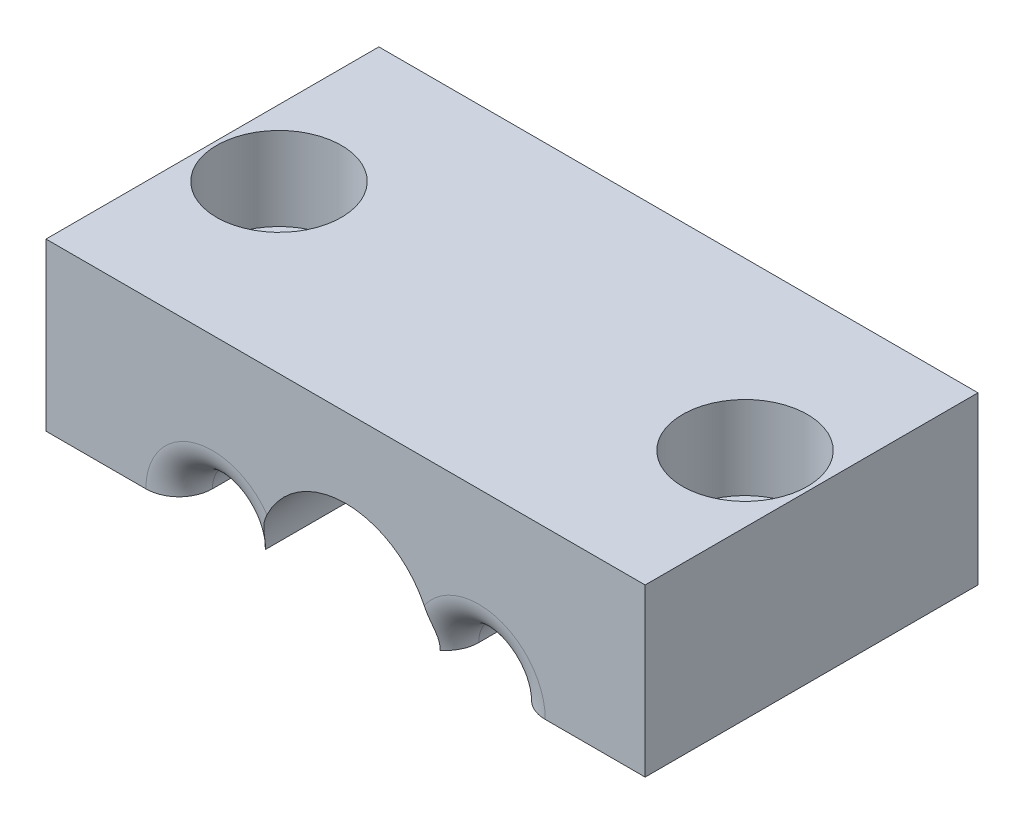
from build123d import *

# Parameters (mm, degrees)
BOSS_EXTRUDE1_DEPTH = 20
SKETCH2_W           = 0.8000000000000007
SKETCH2_H           = 0.7999999999999989
SKETCH2_H_2         = 0.8000000000000007
CHAMFER1_SIZE       = 0.4
FILLET2_R           = 2
SKETCH3_R           = 2.100000000000004
SKETCH3_R_2         = 2.100000000000001
CUT_EXTRUDE1_DEPTH  = 44.163354633534205
SKETCH4_R           = 3.7499999999999996
SKETCH4_R_2         = 3.750000000000006
CUT_EXTRUDE2_DEPTH  = 5


# Some blends are built 0.0001 mm under size
with BuildPart() as part:
    # Sketch1 → Boss-Extrude1 (new body)
    with BuildSketch(Plane.XY):
        with BuildLine():
            Line((0.9198479389646088, 12.89190109356241), (0.9198479389646088, 2.89190109356241))
            Line((0.9198479389646081, 2.89190109356241), (8.919847938964608, 2.89190109356241))
            ThreePointArc((8.919847938964608, 2.8919010935624105), (10.919847938964608, 4.89190109356241), (12.919847938964608, 2.89190109356241))
            Line((12.919847938964608, 2.89190109356241), (13.669847938964606, 2.89190109356241))
            ThreePointArc((13.669847938964608, 2.8919010935624114), (18.919847938964608, 8.14190109356241), (24.169847938964608, 2.89190109356241))
            Line((24.169847938964608, 2.89190109356241), (24.919847938964608, 2.89190109356241))
            ThreePointArc((24.919847938964608, 2.8919010935624105), (26.919847938964608, 4.891901093562406), (28.919847938964608, 2.89190109356241))
            Line((28.919847938964605, 2.89190109356241), (36.91984793896461, 2.89190109356241))
            Line((36.91984793896461, 2.89190109356241), (36.91984793896461, 12.89190109356241))
            Line((36.91984793896461, 12.89190109356241), (0.9198479389646088, 12.89190109356241))
        make_face()
    extrude(amount=BOSS_EXTRUDE1_DEPTH)

    # Sweep2: sweep along a curve in space
    with BuildLine() as sweep2_path:
        ThreePointArc((24.169847938964608, 2.89190109356241, 20), (22.632158540193984, 6.604211694791784, 20), (18.919847938964608, 8.141901093562412, 20))
        ThreePointArc((18.919847938964608, 8.141901093562412, 20), (15.207537337735232, 6.604211694791786, 20), (13.669847938964606, 2.89190109356241, 20))
    # Sketch2 → Sweep2 (sweep)
    with BuildSketch(Plane.XZ.offset(-2.89190109356241)):
        with Locations((14.069847938964607, 13.400000000000006)):
            Rectangle(SKETCH2_W, SKETCH2_H)
        with Locations((14.069847938964607, 10.400000000000004)):
            Rectangle(SKETCH2_W, SKETCH2_H_2)
        with Locations((14.069847938964607, 7.400000000000003)):
            Rectangle(SKETCH2_W, SKETCH2_H_2)
        Polygon((13.669847938964608, 4.8000000000000025), (14.469847938964607, 4.8000000000000025), (14.469847938964609, 4.000000000000002), (13.669847938964608, 4.000000000000002), align=None)
    sweep(path=sweep2_path.line)

    # Chamfer1
    chamfer1_edges = [part.edges().sort_by_distance(p)[0] for p in [
        (18.919847938964608, 7.341901093562408, 4.000000000000002),
        (18.919847938964608, 7.341901093562411, 4.8000000000000025),
        (18.919847938964608, 7.341901093562411, 7.0000000000000036),
        (18.919847938964608, 7.341901093562413, 7.800000000000004),
        (18.919847938964608, 7.341901093562413, 13.800000000000004),
        (18.919847938964608, 7.341901093562411, 13.000000000000005),
        (18.919847938964608, 7.341901093562413, 10.800000000000004),
        (18.919847938964608, 7.341901093562411, 10.000000000000004),
    ]]
    chamfer(chamfer1_edges, length=CHAMFER1_SIZE - 0.0001)  # a hair under: the kernel refuses the full size

    # Fillet2
    # the kernel refuses this fillet: 2 mm, written as the material it takes off along each edge
    with BuildSketch(Plane(origin=(10.919847938964608, 2.89190109356241, 0), x_dir=(-0.003141587485879782, -0.9999950652018582, 0), z_dir=(0.9999950652018582, -0.003141587485879782, 0))) as fillet2_piece_1:
        with BuildLine():
            CenterArc((2 + FILLET2_R, -FILLET2_R), FILLET2_R, 89.99999999999997, 90)
            Line((2 + FILLET2_R, 2.2e-16), (2, 0))
            Line((2, 0), (2, -FILLET2_R))
        make_face()
    revolve(axis=Axis((10.919847938964608, 2.89190109356241, 0), (0, 0, -1)), revolution_arc=359.64000000000004, mode=Mode.SUBTRACT)
    with BuildSketch(Plane(origin=(26.919847938964608, 2.8919010935624057, 0), x_dir=(-0.003141587485879782, -0.9999950652018582, 0), z_dir=(0.9999950652018582, -0.003141587485879782, 0))) as fillet2_piece_2:
        with BuildLine():
            CenterArc((1.9999999999999987 + FILLET2_R, -FILLET2_R), FILLET2_R, 90, 90)
            Line((1.999999999999998, -FILLET2_R), (1.9999999999999987, 0))
            Line((1.9999999999999987, 0), (1.9999999999999987 + FILLET2_R, 0))
        make_face()
    revolve(axis=Axis((26.919847938964608, 2.8919010935624057, 0), (0, 0, -1)), revolution_arc=359.64, mode=Mode.SUBTRACT)
    with BuildSketch(Plane(origin=(10.919847938964608, 2.89190109356241, 20), x_dir=(-0.003141587485879782, -0.9999950652018582, 0), z_dir=(0.9999950652018582, -0.003141587485879782, 0))) as fillet2_piece_3:
        with BuildLine():
            CenterArc((1.9999999999999987 + FILLET2_R, FILLET2_R), FILLET2_R, 180, 90)
            Line((1.999999999999999, FILLET2_R), (1.9999999999999987, 0))
            Line((1.9999999999999987, 0), (1.9999999999999987 + FILLET2_R, 0))
        make_face()
    revolve(axis=Axis((10.919847938964608, 2.89190109356241, 20), (0, 0, -1)), revolution_arc=359.64000000000004, mode=Mode.SUBTRACT)
    with BuildSketch(Plane(origin=(26.919847938964608, 2.8919010935624057, 20), x_dir=(-0.003141587485879782, -0.9999950652018582, 0), z_dir=(0.9999950652018582, -0.003141587485879782, 0))) as fillet2_piece_4:
        with BuildLine():
            CenterArc((1.9999999999999987 + FILLET2_R, FILLET2_R), FILLET2_R, 180, 90)
            Line((1.999999999999998, FILLET2_R), (1.9999999999999987, 0))
            Line((1.9999999999999987, 0), (1.9999999999999987 + FILLET2_R, 0))
        make_face()
    revolve(axis=Axis((26.919847938964608, 2.8919010935624057, 20), (0, 0, -1)), revolution_arc=359.64, mode=Mode.SUBTRACT)

    # Sketch3 → Cut-Extrude1 (cut, through all)
    with BuildSketch(Plane.XZ.offset(-2.89190109356241)):
        with Locations(Location((32.9198479389646, 10, 0), (0, 0, 270))):
            Circle(SKETCH3_R)
        with Locations(Location((4.919847938964609, 10, 0), (0, 0, 270))):
            Circle(SKETCH3_R_2)
    extrude(amount=-CUT_EXTRUDE1_DEPTH, mode=Mode.SUBTRACT)

    # Sketch4 → Cut-Extrude2 (cut)
    with BuildSketch(Plane(origin=(0, 12.89190109356241, 0), x_dir=(1, 0, 0), z_dir=(0, 1, 0))):
        with Locations(Location((4.919847938964609, -10, 0), (0, 0, 270))):
            Circle(SKETCH4_R)
        with Locations(Location((32.9198479389646, -10, 0), (0, 0, 270))):
            Circle(SKETCH4_R_2)
    extrude(amount=-CUT_EXTRUDE2_DEPTH, mode=Mode.SUBTRACT)


solid = part.part
